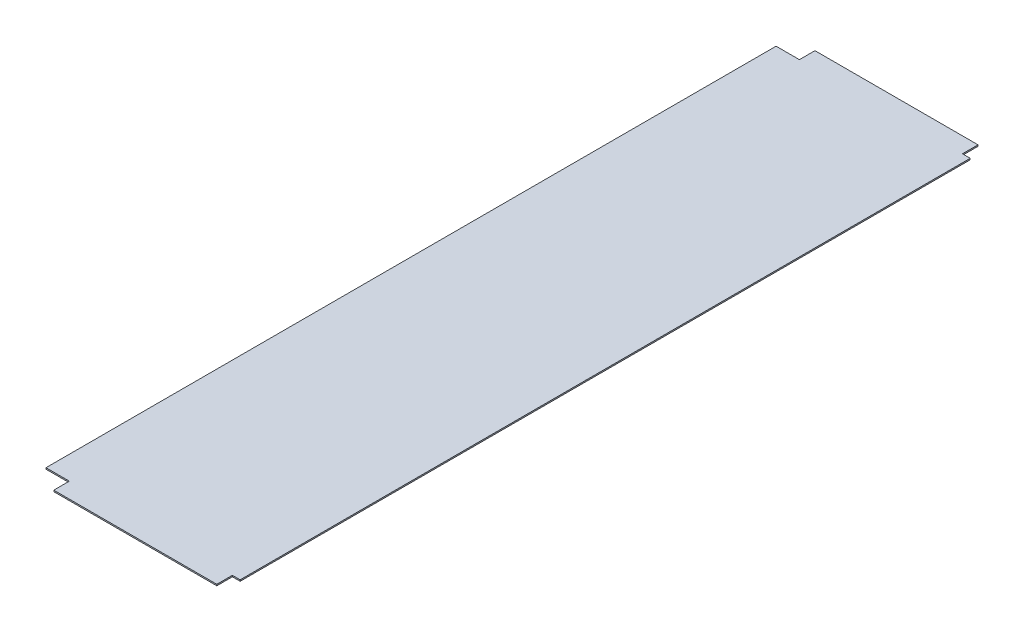
from build123d import *

# Parameters (mm, degrees)
BASE_FLANGE1_DEPTH = 1.7366


# Sheet-metal steps are written as plain solids
with BuildPart() as part:
    # Sketch1 → Base-Flange1 (new body)
    with BuildSketch(Plane(origin=(0, 0, 0), x_dir=(1, 0, 0), z_dir=(0, 1, 0))):
        Polygon((-110, 519), (-110, 499), (-140, 499), (-140, -440), (-110, -440), (-110, -460), (99.7, -460), (99.7, -440), (109.7, -440), (109.7, 499), (99.7, 499), (99.7, 519), align=None)
    extrude(amount=-BASE_FLANGE1_DEPTH)


solid = part.part
